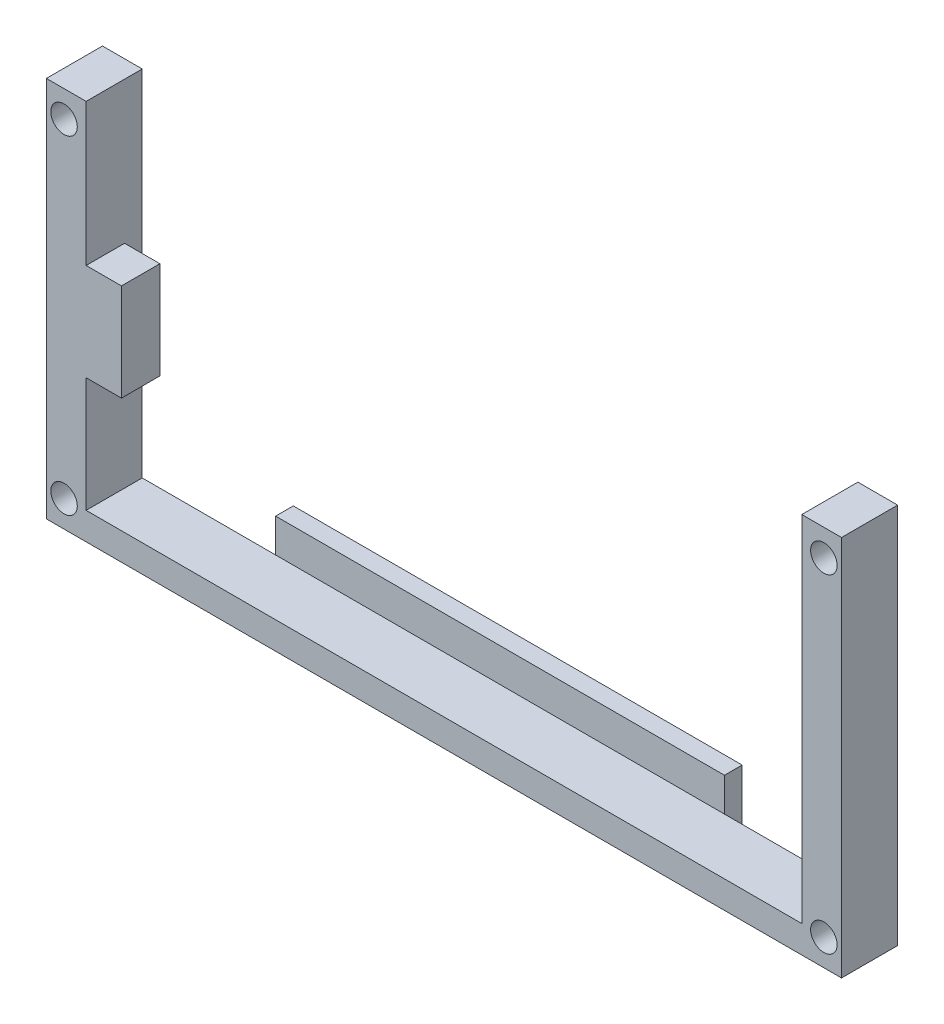
from build123d import *

# Parameters (mm, degrees)
SKETCH1_W           = 90
SKETCH1_H           = 43.18
SKETCH1_W_2         = 81
SKETCH1_H_2         = 37
BOSS_EXTRUDE1_DEPTH = 6.35
SKETCH2_R           = 1.5
CUT_EXTRUDE1_DEPTH  = 10.16
SKETCH4_W           = 4.35
SKETCH4_H           = 11
BOSS_EXTRUDE3_DEPTH = 4
SKETCH5_W           = 81
SKETCH5_H           = 3.09
CUT_EXTRUDE2_DEPTH  = 51.313523033
SKETCH6_W           = 50.8
SKETCH6_H           = 3.09
BOSS_EXTRUDE4_DEPTH = 2
SKETCH7_W           = 50.8
SKETCH7_H           = 2
BOSS_EXTRUDE5_DEPTH = 3.81


with BuildPart() as part:
    # Sketch1 → Boss-Extrude1 (new body)
    with BuildSketch(Plane.XY):
        Rectangle(SKETCH1_W, SKETCH1_H)
        Rectangle(SKETCH1_W_2, SKETCH1_H_2, mode=Mode.SUBTRACT)
    extrude(amount=BOSS_EXTRUDE1_DEPTH)

    # Sketch2 → Cut-Extrude1 (cut)
    with BuildSketch(Plane.XY.offset(6.35)):
        with Locations((43, 18.59)):
            Circle(SKETCH2_R)
        with Locations((-43, 18.59)):
            Circle(SKETCH2_R)
        with Locations((-43, -18.59)):
            Circle(SKETCH2_R)
        with Locations((43, -18.59)):
            Circle(SKETCH2_R)
    extrude(amount=-CUT_EXTRUDE1_DEPTH, mode=Mode.SUBTRACT)

    # Sketch4 → Boss-Extrude3 (add)
    with BuildSketch(Plane(origin=(-40.5, 0, 0), x_dir=(0, 0, -1), z_dir=(1, 0, 0))):
        with Locations((-4.175, 0)):
            Rectangle(SKETCH4_W, SKETCH4_H)
    extrude(amount=BOSS_EXTRUDE3_DEPTH)

    # Sketch5 → Cut-Extrude2 (cut, through all)
    with BuildSketch(Plane(origin=(0, 0, 0), x_dir=(-1, 0, 0), z_dir=(0, 0, -1))):
        with Locations((0, 20.045)):
            Rectangle(SKETCH5_W, SKETCH5_H)
    extrude(amount=-CUT_EXTRUDE2_DEPTH, mode=Mode.SUBTRACT)

    # Sketch6 → Boss-Extrude4 (add)
    with BuildSketch(Plane(origin=(0, 0, 0), x_dir=(-1, 0, 0), z_dir=(0, 0, -1))):
        with Locations((0, -20.045)):
            Rectangle(SKETCH6_W, SKETCH6_H)
    extrude(amount=BOSS_EXTRUDE4_DEPTH)

    # Sketch7 → Boss-Extrude5 (add)
    with BuildSketch(Plane(origin=(0, -18.5, 0), x_dir=(1, 0, 0), z_dir=(0, 1, 0))):
        with Locations((0, 1)):
            Rectangle(SKETCH7_W, SKETCH7_H)
    extrude(amount=BOSS_EXTRUDE5_DEPTH)


solid = part.part
